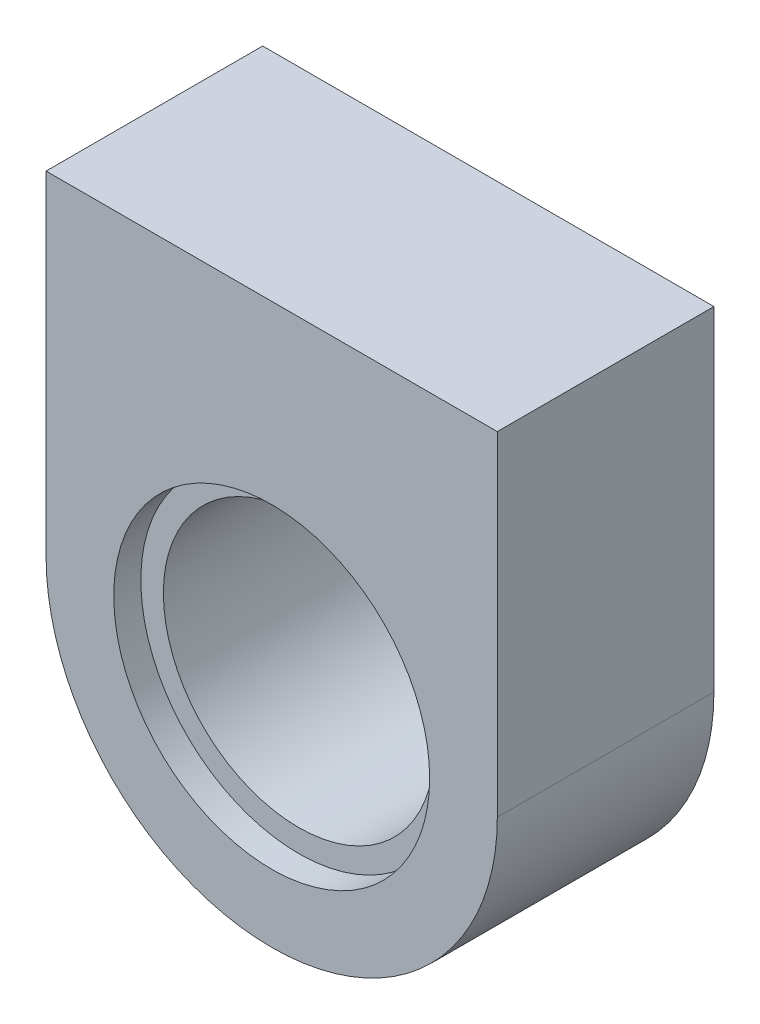
from build123d import *

# Parameters (mm, degrees)
SKETCH_1_W          = 50
SKETCH_1_H          = 62
EXTRUDE_1_DEPTH     = 24
FILLET_1_R          = 25
SKETCH_2_R          = 15
CUT_EXTRUDE_1_DEPTH = 30
SKETCH_3_R          = 17.5
CUT_EXTRUDE_2_DEPTH = 3


with BuildPart() as part:
    # 草图1 → 拉伸1 (new body)
    with BuildSketch(Plane.XY):
        with Locations((25, -31)):
            Rectangle(SKETCH_1_W, SKETCH_1_H)
    extrude(amount=EXTRUDE_1_DEPTH)

    # 圆角1
    fillet_1_edges = [part.edges().sort_by_distance(p)[0] for p in [
        (0, -62, 12),
        (50, -62, 12),
    ]]
    fillet(fillet_1_edges, radius=FILLET_1_R - 0.0001)  # a hair under: the kernel refuses the full size

    # 草图2 → 切除-拉伸1 (cut)
    with BuildSketch(Plane(origin=(0, 0, 0), x_dir=(-1, 0, 0), z_dir=(0, 0, -1))):
        with Locations((-25, -37)):
            Circle(SKETCH_2_R)
    extrude(amount=-CUT_EXTRUDE_1_DEPTH, mode=Mode.SUBTRACT)

    # 草图3 → 切除-拉伸2 (cut)
    with BuildSketch(Plane.XY.offset(24)):
        with Locations((25, -37)):
            Circle(SKETCH_3_R)
    extrude(amount=-CUT_EXTRUDE_2_DEPTH, mode=Mode.SUBTRACT)


solid = part.part
